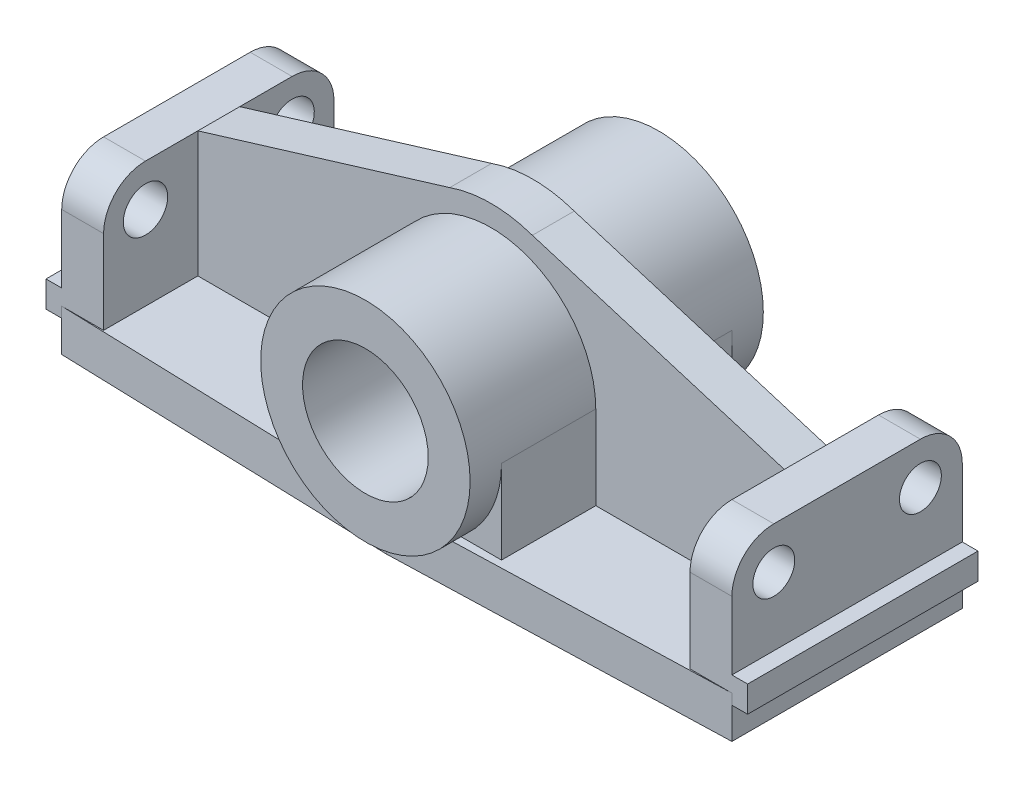
from build123d import *
from build123d.topology import SkipClean

# Parameters (mm, degrees)
BOSS_EXTRUDE4_DEPTH     = 6.35
BOSS_EXTRUDE5_START     = -34.925
BOSS_EXTRUDE5_OUTLINE_R = 19.05
BOSS_EXTRUDE5_DEPTH     = 34.925
SKETCH5_R               = 6.35
CUT_EXTRUDE1_DEPTH      = 12.7
SKETCH6_R               = 6.731
CUT_EXTRUDE2_DEPTH      = 12.7
SKETCH8_W               = 34.925
SKETCH8_H               = 7.9375
BOSS_EXTRUDE6_DEPTH     = 4.7625
SKETCH9_W               = 34.925
SKETCH9_H               = 7.9375
BOSS_EXTRUDE7_DEPTH     = 4.7625
FILLET1_R               = 12.7
FILLET1_OF_MIRROR1_R    = 12.7
SKETCH10_R              = 31.75
SKETCH10_R_2            = 19.05
BOSS_EXTRUDE8_DEPTH     = 44.45
BOSS_EXTRUDE9_DEPTH     = 12.7


# Read off the part's stored shape, not the designer's step: Boss-Extrude5
with BuildPart() as part:
    # Sketch2 → Boss-Extrude4 (new body)
    with BuildSketch(Plane.XY):
        with BuildLine():
            ThreePointArc((-12.522963776, 74.083126299), (-37.56705413, 31.749689456), (0, 0))
            Line((0, 0), (0, 6.35))
            ThreePointArc((0, 6.35), (-31.75, 38.1), (0, 69.85))
            Line((0, 69.85), (0, 76.2))
            ThreePointArc((0, 76.2), (-6.350310544, 75.66705413), (-12.522963776, 74.083126299))
        make_face()
        with BuildLine():
            Line((0, 6.35), (0, 0))
            ThreePointArc((0, 0), (26.940768363, 11.159231637), (38.1, 38.1))
            ThreePointArc((38.1, 38.1), (31.054266373, 60.173571076), (12.522963776, 74.083126299))
            ThreePointArc((12.522963776, 74.083126299), (6.350310544, 75.66705413), (0, 76.2))
            Line((0, 76.2), (0, 69.85))
            ThreePointArc((0, 69.85), (22.450640303, 60.550640303), (31.75, 38.1))
            ThreePointArc((31.75, 38.1), (22.450640303, 15.649359697), (0, 6.35))
        make_face()
        with BuildLine():
            ThreePointArc((38.1, 38.1), (26.940768363, 11.159231637), (0, 0))
            Line((0, 0), (88.9, 0))
            Line((88.9, 0), (88.9, 50.8))
            Line((88.9, 50.8), (12.522963776, 74.083126299))
            ThreePointArc((12.522963776, 74.083126299), (31.054266373, 60.173571076), (38.1, 38.1))
        make_face()
        with BuildLine():
            Line((-88.9, 0), (0, 0))
            ThreePointArc((0, 0), (-37.56705413, 31.749689456), (-12.522963776, 74.083126299))
            Line((-12.522963776, 74.083126299), (-88.9, 50.8))
            Line((-88.9, 50.8), (-88.9, 0))
        make_face()
    boss_extrude4 = extrude(amount=BOSS_EXTRUDE4_DEPTH)

    # Boss-Extrude5 outline → Boss-Extrude5 (add)
    with BuildSketch(Plane(origin=(0, 0, 0), x_dir=(-1, 0, 0), z_dir=(0, 0, -1)).offset(BOSS_EXTRUDE5_START)):
        with BuildLine():
            Line((101.6, 0), (101.6, 50.8))
            Line((101.6, 50.8), (88.9, 50.8))
            Line((88.9, 50.8), (88.9, 12.7))
            Line((88.9, 12.7), (31.75, 12.7))
            Line((31.75, 12.7), (31.75, 38.1))
            ThreePointArc((31.75, 38.1), (0, 69.85), (-31.75, 38.1))
            Line((-31.75, 38.1), (-31.75, 12.7))
            Line((-31.75, 12.7), (-88.9, 12.7))
            Line((-88.9, 12.7), (-88.9, 50.8))
            Line((-88.9, 50.8), (-101.6, 50.8))
            Line((-101.6, 50.8), (-101.6, 0))
            Line((-101.6, 0), (101.6, 0))
        make_face()
        with Locations((0, 38.1)):
            Circle(BOSS_EXTRUDE5_OUTLINE_R, mode=Mode.SUBTRACT)
    boss_extrude5 = extrude(amount=BOSS_EXTRUDE5_DEPTH)

    # Sketch5 → Cut-Extrude1 (cut)
    with BuildSketch(Plane(origin=(101.6, 0, 0), x_dir=(0, 0, -1), z_dir=(1, 0, 0))):
        with Locations((-22.225, 38.1)):
            Circle(SKETCH5_R)
    cut_extrude1 = extrude(amount=-CUT_EXTRUDE1_DEPTH, mode=Mode.SUBTRACT)

    # Sketch6 → Cut-Extrude2 (cut)
    with BuildSketch(Plane.ZY.offset(101.6)):
        with Locations(Location((22.225, 38.1, 0), (0, 0, 270))):
            Circle(SKETCH6_R)
    cut_extrude2 = extrude(amount=-CUT_EXTRUDE2_DEPTH, mode=Mode.SUBTRACT)

    # Sketch8 → Boss-Extrude6 (add)
    with BuildSketch(Plane(origin=(101.6, 0, 0), x_dir=(0, 0, -1), z_dir=(1, 0, 0))):
        with Locations((-17.4625, 13.49375)):
            Rectangle(SKETCH8_W, SKETCH8_H)
    boss_extrude6 = extrude(amount=BOSS_EXTRUDE6_DEPTH)

    # Sketch9 → Boss-Extrude7 (add)
    with BuildSketch(Plane.ZY.offset(101.6)):
        with Locations((17.4625, 13.49375)):
            Rectangle(SKETCH9_W, SKETCH9_H)
    boss_extrude7 = extrude(amount=BOSS_EXTRUDE7_DEPTH)

    # Fillet1
    fillet1_edges = [part.edges().sort_by_distance(p)[0] for p in [
        (95.25, 50.8, 34.925),
        (-95.25, 50.8, 34.925),
    ]]
    fillet(fillet1_edges, radius=FILLET1_R)

    # Mirror1: Boss-Extrude4, Boss-Extrude5, Cut-Extrude1, Cut-Extrude2, Boss-Extrude6, Boss-Extrude7 across plane
    add(boss_extrude4.mirror(Plane.XY))
    add(boss_extrude5.mirror(Plane.XY))
    add(cut_extrude1.mirror(Plane.XY), mode=Mode.SUBTRACT)
    add(cut_extrude2.mirror(Plane.XY), mode=Mode.SUBTRACT)
    add(boss_extrude6.mirror(Plane.XY))
    add(boss_extrude7.mirror(Plane.XY))

    # Fillet1 of Mirror1
    fillet1_of_mirror1_edges = [part.edges().sort_by_distance(p)[0] for p in [
        (95.25, 50.8, -34.925),
        (-95.25, 50.8, -34.925),
    ]]
    fillet(fillet1_of_mirror1_edges, radius=FILLET1_OF_MIRROR1_R)

    # Sketch10 → Boss-Extrude8 (add, symmetric)
    with SkipClean():  # the faces are left unmerged after this step: merging them gives an invalid solid
        with BuildSketch(Plane.XY):
            with Locations((0, 38.1)):
                Circle(SKETCH10_R)
            with Locations((0, 38.1)):
                Circle(SKETCH10_R_2, mode=Mode.SUBTRACT)
        extrude(amount=BOSS_EXTRUDE8_DEPTH, both=True)

    # Sketch11 → Boss-Extrude9 (add)
    with SkipClean():  # the faces are left unmerged after this step: merging them gives an invalid solid
        with BuildSketch(Plane.XZ):
            Polygon((101.6, 34.925), (0, 38.1), (-101.6, 34.925), align=None)
            Polygon((-101.6, -34.925), (0, -38.1), (101.6, -34.925), align=None)
        extrude(amount=-BOSS_EXTRUDE9_DEPTH)


solid = part.part
